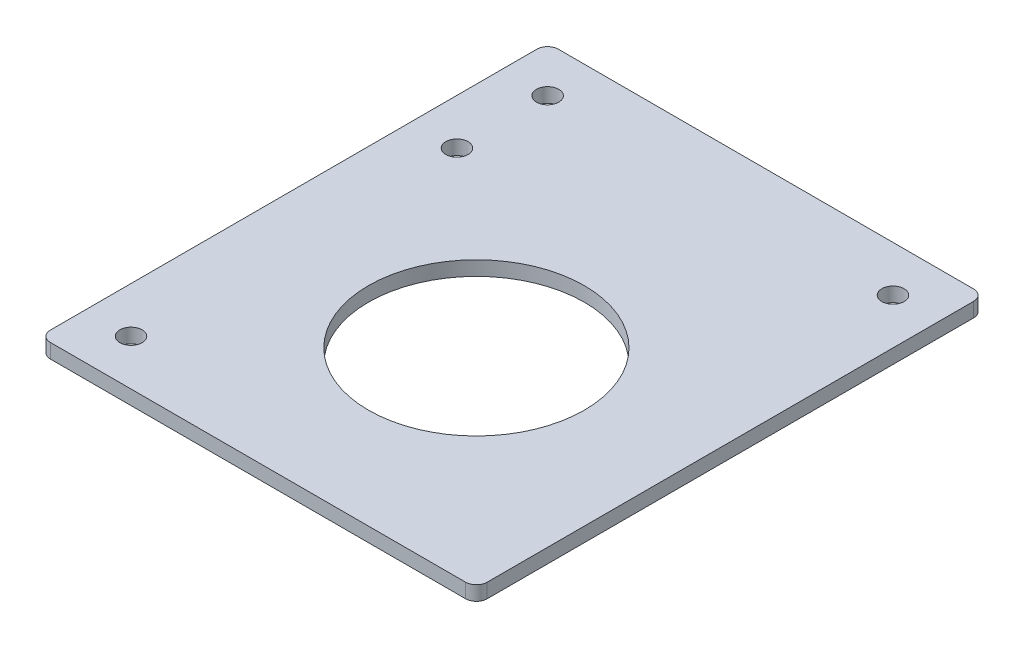
from build123d import *

# Parameters (mm, degrees)
SKETCH1_W           = 121.4
SKETCH1_H           = 141.2
SKETCH1_R           = 30
SKETCH1_R_2         = 3.1
BOSS_EXTRUDE1_DEPTH = 4
FILLET1_R           = 3


with BuildPart() as part:
    # Sketch1 → Boss-Extrude1 (new body)
    with BuildSketch(Plane(origin=(0, 0, 0), x_dir=(1, 0, 0), z_dir=(0, 1, 0))):
        with Locations((61.417527055, -45.2)):
            Rectangle(SKETCH1_W, SKETCH1_H)
        with Locations((64.217527055, -57.9)):
            Circle(SKETCH1_R, mode=Mode.SUBTRACT)
        with Locations((13.417527055, 12.7)):
            Circle(SKETCH1_R_2, mode=Mode.SUBTRACT)
        with Locations((109.417527055, 12.7)):
            Circle(SKETCH1_R_2, mode=Mode.SUBTRACT)
        with Locations((13.417527055, -103.1)):
            Circle(SKETCH1_R_2, mode=Mode.SUBTRACT)
        with Locations((13.417527055, -12.5)):
            Circle(SKETCH1_R_2, mode=Mode.SUBTRACT)
    extrude(amount=BOSS_EXTRUDE1_DEPTH)

    # Fillet1
    fillet1_edges = [part.edges().sort_by_distance(p)[0] for p in [
        (122.117527055, 2, -25.4),
        (122.117527055, 2, 115.8),
        (0.717527055, 2, 115.8),
        (0.717527055, 2, -25.4),
    ]]
    fillet(fillet1_edges, radius=FILLET1_R)


solid = part.part
